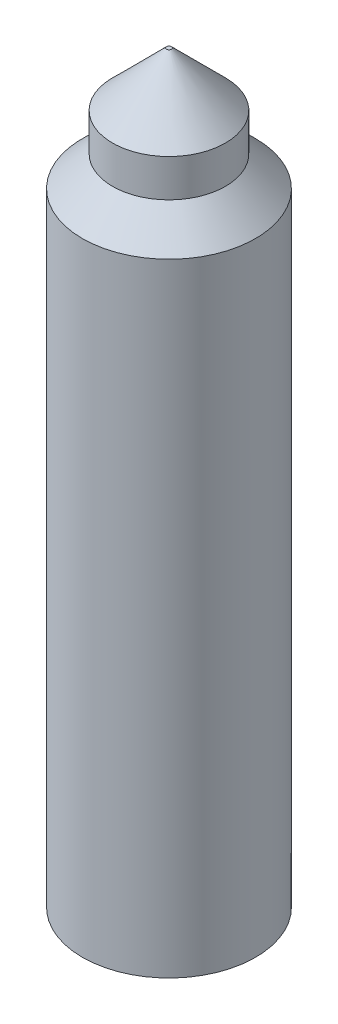
from build123d import *

# Parameters (mm, degrees)
SKETCH1_R           = 12.8
BOSS_EXTRUDE1_DEPTH = 100
SKETCH3_R           = 8.348764046
BOSS_EXTRUDE3_DEPTH = 10
CHAMFER3_SIZE       = 8
CHAMFER4_SIZE       = 8


with BuildPart() as part:
    # Sketch1 → Boss-Extrude1 (new body)
    with BuildSketch(Plane(origin=(0, 0, 0), x_dir=(1, 0, 0), z_dir=(0, 1, 0))):
        with Locations(Location((0, 0, 0), (0, 0, 270))):
            Circle(SKETCH1_R)
    extrude(amount=BOSS_EXTRUDE1_DEPTH)

    # Sketch3 → Boss-Extrude3 (add)
    with BuildSketch(Plane(origin=(0, 100, 0), x_dir=(1, 0, 0), z_dir=(0, 1, 0))):
        with Locations(Location((0, 0, 0), (0, 0, 270))):
            Circle(SKETCH3_R)
    extrude(amount=BOSS_EXTRUDE3_DEPTH)

    # Chamfer3
    chamfer3_edges = [part.edges().sort_by_distance(p)[0] for p in [
        (0, 110, -8.348764046),
    ]]
    chamfer(chamfer3_edges, length=CHAMFER3_SIZE)

    # Chamfer4
    # the kernel refuses this chamfer: 8 mm, written as the material it takes off along each edge
    with BuildSketch(Plane(origin=(0, 100, 0), x_dir=(0, 0, 1), z_dir=(-1, 0, 0))) as chamfer4_piece_1_section:
        Polygon((12.8 - CHAMFER4_SIZE, 0), (12.8, -CHAMFER4_SIZE), (12.8, 0), align=None)
    chamfer4_piece_1 = revolve(axis=Axis((0, 100, 0), (0, 1, 0)), mode=Mode.PRIVATE)
    chamfer4_piece_1 = chamfer4_piece_1 - Plane(origin=(0, 94.200473473, 0), x_dir=(0, 0, 1), z_dir=(0, -1, 0)) * Cylinder(8.348764046, 52, mode=Mode.PRIVATE)
    add(chamfer4_piece_1, mode=Mode.SUBTRACT)


solid = part.part
